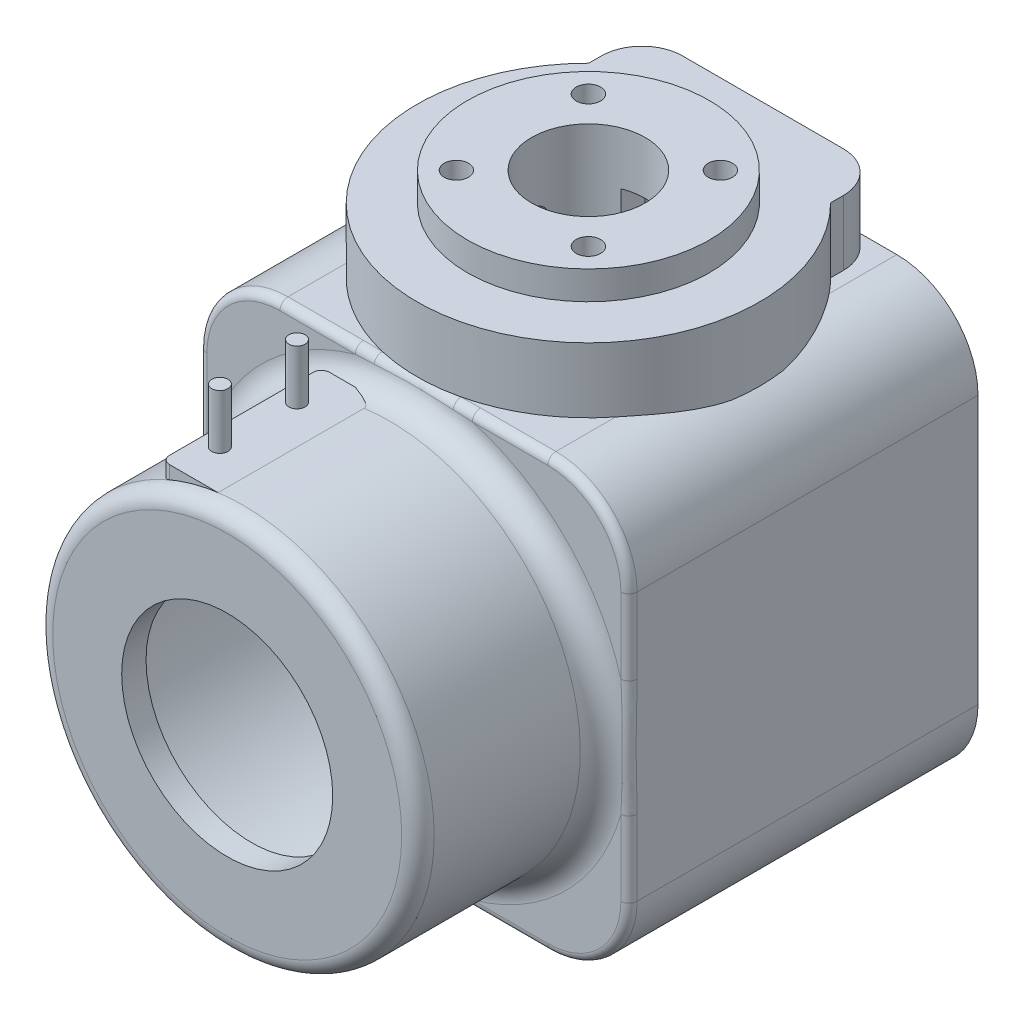
from build123d import *

# Parameters (mm, degrees)
BOSS_EXTRUDE1_DEPTH             = 0.2
BOSS_EXTRUDE1_DEPTH_BACK        = 22.8
SKETCH1_R                       = 23.5
SKETCH1_R_2                     = 21.1
SKETCH2_W                       = 53
SKETCH2_H                       = 53
SKETCH2_W_2                     = 43
SKETCH2_H_2                     = 43
BOSS_EXTRUDE2_DEPTH             = 40
SKETCH3_W                       = 53
SKETCH3_H                       = 53
SKETCH3_R                       = 23.5
BOSS_EXTRUDE3_DEPTH             = 3
SKETCH4_R                       = 23.5
SKETCH4_R_2                     = 13
BOSS_EXTRUDE4_DEPTH             = 3
FILLET1_R                       = 3
FILLET2_R                       = 2
FILLET3_R                       = 10
FILLET4_R                       = 5
SKETCH5_R                       = 7
SKETCH5_R_2                     = 1.5
CUT_EXTRUDE1_DEPTH              = 12
BOSS_EXTRUDE5_START             = 8
SKETCH7_R                       = 1.5
SKETCH7_R_2                     = 7
BOSS_EXTRUDE5_DEPTH             = 8
SKETCH8_W                       = 16
SKETCH8_H                       = 10
CUT_EXTRUDE2_DEPTH              = 12
SKETCH9_W                       = 5
SKETCH9_H                       = 10
CUT_EXTRUDE3_DEPTH              = 9
CUT_EXTRUDE4_DEPTH              = 3
BOSS_EXTRUDE6_DEPTH             = 9
BOSS_EXTRUDE7_START             = 3.5
SKETCH13_R                      = 14.9
SKETCH13_R_2                    = 1.5
SKETCH13_R_3                    = 7
BOSS_EXTRUDE7_DEPTH             = 3.5
SKETCH14_R                      = 1
BOSS_EXTRUDE8_DEPTH             = 3.5
BOSS_EXTRUDE8_DIRECTION_2_REACH = 92.733
BOSS_EXTRUDE10_START            = -3.208808
BOSS_EXTRUDE10_DEPTH            = 2.5
SKETCH17_R                      = 21.1
CUT_EXTRUDE5_DEPTH              = 23
SKETCH19_R                      = 2
CUT_EXTRUDE7_DEPTH              = 22.5
FILLET5_R                       = 5
FILLET6_R                       = 1
SKETCH21_R                      = 1.5
CUT_EXTRUDE8_DEPTH              = 10


with BuildPart() as part:
    # Sketch1 → Boss-Extrude1 (new, two sides: drawn at the far end of the back side and taken through both)
    with BuildSketch(Plane.XY.offset(-BOSS_EXTRUDE1_DEPTH_BACK)):
        with Locations((11.965150094, 27.578631729)):
            Circle(SKETCH1_R)
        with Locations((11.965150094, 27.578631729)):
            Circle(SKETCH1_R_2, mode=Mode.SUBTRACT)
    extrude(amount=BOSS_EXTRUDE1_DEPTH + BOSS_EXTRUDE1_DEPTH_BACK)

    # Sketch2 → Boss-Extrude2 (add)
    with BuildSketch(Plane(origin=(0, 0, -22.8), x_dir=(-1, 0, 0), z_dir=(0, 0, -1))):
        with Locations((-11.965150094, 27.578631729)):
            Rectangle(SKETCH2_W, SKETCH2_H)
        with Locations((-11.965150094, 27.578631729)):
            Rectangle(SKETCH2_W_2, SKETCH2_H_2, mode=Mode.SUBTRACT)
    extrude(amount=BOSS_EXTRUDE2_DEPTH)

    # Sketch3 → Boss-Extrude3 (add)
    with BuildSketch(Plane.XY.offset(-22.8)):
        with Locations((11.965150094, 27.578631729)):
            Rectangle(SKETCH3_W, SKETCH3_H)
        with Locations((11.965150094, 27.578631729)):
            Circle(SKETCH3_R, mode=Mode.SUBTRACT)
    extrude(amount=BOSS_EXTRUDE3_DEPTH)

    # Sketch4 → Boss-Extrude4 (add)
    with BuildSketch(Plane.XY.offset(0.2)):
        with Locations((11.965150094, 27.578631729)):
            Circle(SKETCH4_R)
        with Locations((11.965150094, 27.578631729)):
            Circle(SKETCH4_R_2, mode=Mode.SUBTRACT)
    extrude(amount=BOSS_EXTRUDE4_DEPTH)

    # Fillet1
    fillet1_edges = [part.edges().sort_by_distance(p)[0] for p in [
        (-11.534849906, 27.578631729, -19.8),
    ]]
    fillet(fillet1_edges, radius=FILLET1_R - 0.0001)  # a hair under: the kernel refuses the full size

    # Fillet2
    fillet2_edges = [part.edges().sort_by_distance(p)[0] for p in [
        (-11.534849906, 27.578631729, 3.2),
    ]]
    fillet(fillet2_edges, radius=FILLET2_R)

    # Fillet3
    fillet3_edges = [part.edges().sort_by_distance(p)[0] for p in [
        (-14.534849906, 54.078631729, -41.3),
        (38.465150094, 54.078631729, -41.3),
        (38.465150094, 1.078631729, -41.3),
        (-14.534849906, 1.078631729, -41.3),
    ]]
    fillet(fillet3_edges, radius=FILLET3_R)

    # Fillet4
    fillet4_edges = [part.edges().sort_by_distance(p)[0] for p in [
        (33.465150094, 6.078631729, -42.8),
        (-9.534849906, 6.078631729, -42.8),
        (-9.534849906, 49.078631729, -42.8),
        (33.465150094, 49.078631729, -42.8),
    ]]
    fillet(fillet4_edges, radius=FILLET4_R)

    # Sketch5 → Cut-Extrude1 (cut)
    with BuildSketch(Plane(origin=(0, 54.078631729, 0), x_dir=(1, 0, 0), z_dir=(0, 1, 0))):
        with Locations(Location((11.965150094, 41.3, 0), (0, 0, 270))):
            Circle(SKETCH5_R)
        with Locations(Location((3.83342211, 49.431727984, 0), (0, 0, 270))):
            Circle(SKETCH5_R_2)
        with Locations(Location((20.096878077, 49.431727984, 0), (0, 0, 270))):
            Circle(SKETCH5_R_2)
        with Locations(Location((20.096878077, 33.168272016, 0), (0, 0, 270))):
            Circle(SKETCH5_R_2)
        with Locations(Location((3.83342211, 33.168272016, 0), (0, 0, 270))):
            Circle(SKETCH5_R_2)
    extrude(amount=-CUT_EXTRUDE1_DEPTH, mode=Mode.SUBTRACT)

    # Sketch7 → Boss-Extrude5 (add)
    with BuildSketch(Plane(origin=(0, 54.078631729, 0), x_dir=(1, 0, 0), z_dir=(0, 1, 0)).offset(BOSS_EXTRUDE5_START)):
        with BuildLine():
            Line((-2.934849906, 41.3), (-2.934849906, 62.8))
            Line((-2.934849906, 62.8), (26.865150094, 62.8))
            Line((26.865150094, 62.8), (26.865150094, 41.3))
            ThreePointArc((26.865150094, 41.3), (11.965150094, 26.4), (-2.934849906, 41.3))
        make_face()
        with Locations(Location((20.096878077, 33.168272016, 0), (0, 0, 270))):
            Circle(SKETCH7_R, mode=Mode.SUBTRACT)
        with Locations(Location((20.096878077, 49.431727984, 0), (0, 0, 270))):
            Circle(SKETCH7_R, mode=Mode.SUBTRACT)
        with Locations(Location((3.83342211, 49.431727984, 0), (0, 0, 270))):
            Circle(SKETCH7_R, mode=Mode.SUBTRACT)
        with Locations(Location((11.965150094, 41.3, 0), (0, 0, 270))):
            Circle(SKETCH7_R_2, mode=Mode.SUBTRACT)
        with Locations(Location((3.83342211, 33.168272016, 0), (0, 0, 270))):
            Circle(SKETCH7_R, mode=Mode.SUBTRACT)
    extrude(amount=-BOSS_EXTRUDE5_DEPTH)

    # Sketch8 → Cut-Extrude2 (cut)
    with BuildSketch(Plane(origin=(0, 0, -62.8), x_dir=(-1, 0, 0), z_dir=(0, 0, -1))):
        with Locations((-11.965150094, 54.078631729)):
            Rectangle(SKETCH8_W, SKETCH8_H)
    extrude(amount=-CUT_EXTRUDE2_DEPTH, mode=Mode.SUBTRACT)

    # Sketch9 → Cut-Extrude3 (cut)
    with BuildSketch(Plane(origin=(0, 0, -50.8), x_dir=(-1, 0, 0), z_dir=(0, 0, -1))):
        with Locations((-11.965150094, 54.078631729)):
            Rectangle(SKETCH9_W, SKETCH9_H)
    extrude(amount=-CUT_EXTRUDE3_DEPTH, mode=Mode.SUBTRACT)

    # Sketch10 → Cut-Extrude4 (cut)
    with BuildSketch(Plane.XZ.offset(-49.078631729)):
        Polygon((6.119612537, -51.71791841), (6.956416311, -48.59492421), (4.670225884, -46.308733783), (1.547231683, -47.145537557), (0.710427909, -50.268531758), (2.996618336, -52.554722184), align=None)
        Polygon((22.383068504, -47.145537557), (19.260074303, -46.308733783), (16.973883877, -48.59492421), (17.810687651, -51.71791841), (20.933681851, -52.554722184), (23.219872278, -50.268531758), align=None)
        Polygon((1.547231683, -35.454462443), (4.670225884, -36.291266217), (6.956416311, -34.00507579), (6.119612537, -30.88208159), (2.996618336, -30.045277816), (0.710427909, -32.331468242), align=None)
        Polygon((17.810687651, -30.88208159), (16.973883877, -34.00507579), (19.260074303, -36.291266217), (22.383068504, -35.454462443), (23.219872278, -32.331468242), (20.933681851, -30.045277816), align=None)
    extrude(amount=-CUT_EXTRUDE4_DEPTH, mode=Mode.SUBTRACT)

    # Sketch12 → Boss-Extrude6 (add)
    with BuildSketch(Plane(origin=(0, 62.078631729, 0), x_dir=(1, 0, 0), z_dir=(0, 1, 0))):
        with BuildLine():
            Line((26.865150094, 56.239879518), (26.865150094, 41.3))
            ThreePointArc((26.865150094, 41.3), (11.965150094, 26.4), (-2.934849906, 41.3))
            Line((-2.934849906, 41.3), (-2.934849906, 56.239879518))
            ThreePointArc((-2.934849906, 56.239879518), (11.965150094, 20.2), (26.865150094, 56.239879518))
        make_face()
    extrude(amount=-BOSS_EXTRUDE6_DEPTH)

    # Sketch13 → Boss-Extrude7 (add)
    with BuildSketch(Plane(origin=(0, 62.078631729, 0), x_dir=(1, 0, 0), z_dir=(0, 1, 0)).offset(BOSS_EXTRUDE7_START)):
        with Locations(Location((11.965150094, 41.3, 0), (0, 0, 270))):
            Circle(SKETCH13_R)
        with Locations(Location((20.096878077, 33.168272016, 0), (0, 0, 270))):
            Circle(SKETCH13_R_2, mode=Mode.SUBTRACT)
        with Locations(Location((20.096878077, 49.431727984, 0), (0, 0, 270))):
            Circle(SKETCH13_R_2, mode=Mode.SUBTRACT)
        with Locations(Location((3.83342211, 49.431727984, 0), (0, 0, 270))):
            Circle(SKETCH13_R_2, mode=Mode.SUBTRACT)
        with Locations(Location((11.965150094, 41.3, 0), (0, 0, 270))):
            Circle(SKETCH13_R_3, mode=Mode.SUBTRACT)
        with Locations(Location((3.83342211, 33.168272016, 0), (0, 0, 270))):
            Circle(SKETCH13_R_2, mode=Mode.SUBTRACT)
    extrude(amount=-BOSS_EXTRUDE7_DEPTH)

    # Sketch14 → Boss-Extrude8 (add)
    with BuildSketch(Plane(origin=(0, 54.078631729, 0), x_dir=(1, 0, 0), z_dir=(0, 1, 0))):
        with Locations(Location((4.065118101, 3.797164006, 0), (0, 0, 270))):
            Circle(SKETCH14_R)
        with Locations(Location((4.065118101, 13.297164006, 0), (0, 0, 270))):
            Circle(SKETCH14_R)
    extrude(amount=BOSS_EXTRUDE8_DEPTH)

    # Sketch14 → Boss-Extrude8 direction 2 (add, up to next)
    with BuildSketch(Plane(origin=(0, 54.078631729, 0), x_dir=(1, 0, 0), z_dir=(0, 1, 0)), mode=Mode.PRIVATE) as boss_extrude8_direction_2_sk1:
        with Locations(Location((4.065118101, 3.797164006, 0), (0, 0, 270))):
            Circle(SKETCH14_R)
    boss_extrude8_direction_2_tool1 = extrude(boss_extrude8_direction_2_sk1.sketch, amount=-BOSS_EXTRUDE8_DIRECTION_2_REACH, mode=Mode.PRIVATE) - part.part
    # Sketch14 → Boss-Extrude8 direction 2 (add, up to next)
    with BuildSketch(Plane(origin=(0, 54.078631729, 0), x_dir=(1, 0, 0), z_dir=(0, 1, 0)), mode=Mode.PRIVATE) as boss_extrude8_direction_2_sk2:
        with Locations(Location((4.065118101, 13.297164006, 0), (0, 0, 270))):
            Circle(SKETCH14_R)
    boss_extrude8_direction_2_tool2 = extrude(boss_extrude8_direction_2_sk2.sketch, amount=-BOSS_EXTRUDE8_DIRECTION_2_REACH, mode=Mode.PRIVATE) - part.part
    add(boss_extrude8_direction_2_tool1.solids().sort_by_distance((4.065118, 54.078632, -3.797164))[0])
    add(boss_extrude8_direction_2_tool2.solids().sort_by_distance((4.065118, 54.078632, -13.297164))[0])

    # Sketch16 → Boss-Extrude10 (add)
    with BuildSketch(Plane(origin=(0, 54.078631729, 0), x_dir=(1, 0, 0), z_dir=(0, 1, 0)).offset(BOSS_EXTRUDE10_START)):
        with BuildLine():
            Line((2.865150094, -1.199121867), (10.215150094, -1.199121867))
            ThreePointArc((10.215150094, -1.199121867), (10.922256875, -0.906228648), (11.215150094, -0.199121867))
            Line((11.215150094, -0.199121867), (11.215150094, 8.606564963))
            Line((11.215150094, 8.606564963), (11.965150094, 9.356564963))
            Line((11.965150094, 9.356564963), (11.965150094, 17.500878133))
            ThreePointArc((11.965150094, 17.500878133), (11.672256875, 18.207984914), (10.965150094, 18.500878133))
            Line((10.965150094, 18.500878133), (2.865150094, 18.500878133))
            ThreePointArc((2.865150094, 18.500878133), (2.158043312, 18.207984914), (1.865150094, 17.500878133))
            Line((1.865150094, 17.500878133), (1.865150094, 15.047164006))
            Line((1.865150094, 15.047164006), (1.865150094, 2.047164006))
            Line((1.865150094, 2.047164006), (1.865150094, -0.199121867))
            ThreePointArc((1.865150094, -0.199121867), (2.158043312, -0.906228648), (2.865150094, -1.199121867))
        make_face()
    extrude(amount=-BOSS_EXTRUDE10_DEPTH)

    # Sketch17 → Cut-Extrude5 (cut)
    with BuildSketch(Plane(origin=(0, 0, -22.8), x_dir=(-1, 0, 0), z_dir=(0, 0, -1))):
        with Locations(Location((-11.965150094, 27.578631729, 0), (0, 0, 180))):
            Circle(SKETCH17_R)
    extrude(amount=-CUT_EXTRUDE5_DEPTH, mode=Mode.SUBTRACT)

    # Sketch19 → Cut-Extrude7 (cut)
    with BuildSketch(Plane.ZY.offset(14.534849906)):
        with Locations(Location((-41.3, 56.078631729, 0), (0, 0, 270))):
            Circle(SKETCH19_R)
    extrude(amount=-CUT_EXTRUDE7_DEPTH, mode=Mode.SUBTRACT)

    # Fillet5
    fillet5_edges = [part.edges().sort_by_distance(p)[0] for p in [
        (26.865150094, 58.078631729, -62.8),
        (-2.934849906, 58.078631729, -62.8),
    ]]
    fillet(fillet5_edges, radius=FILLET5_R)

    # Fillet6
    fillet6_edges = [part.edges().sort_by_distance(p)[0] for p in [
        (35.536217905, 4.007563917, -19.8),
        (-14.534849906, 27.578631729, -19.8),
        (-11.605917718, 4.007563917, -19.8),
        (-11.605917718, 51.149699541, -19.8),
        (38.465150094, 27.578631729, -19.8),
        (11.965150094, 54.078631729, -19.8),
        (-14.534849906, 27.578631729, -19.8),
        (11.965150094, 1.078631729, -19.8),
        (38.465150094, 27.578631729, -19.8),
        (11.965150094, 54.078631729, -19.8),
        (35.536217905, 51.149699541, -19.8),
        (11.965150094, 1.078631729, -19.8),
    ]]
    fillet(fillet6_edges, radius=FILLET6_R)

    # Sketch21 → Cut-Extrude8 (cut)
    with BuildSketch(Plane(origin=(0, 0, -62.8), x_dir=(-1, 0, 0), z_dir=(0, 0, -1))):
        with Locations((-33.768450952, 49.381932588)):
            Circle(SKETCH21_R)
        with Locations((9.838150765, 49.381932588)):
            Circle(SKETCH21_R)
        with Locations((9.838150765, 5.77533087)):
            Circle(SKETCH21_R)
        with Locations((-33.768450952, 5.77533087)):
            Circle(SKETCH21_R)
    extrude(amount=-CUT_EXTRUDE8_DEPTH, mode=Mode.SUBTRACT)


solid = part.part
